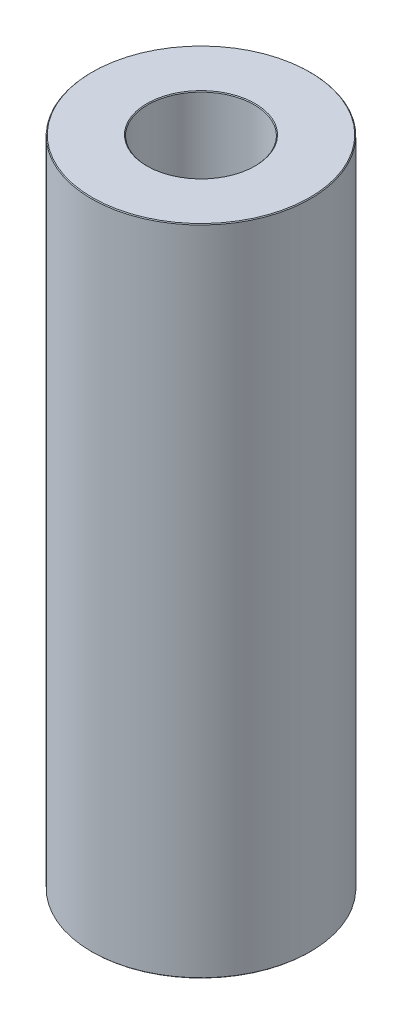
from build123d import *

# Parameters (mm, degrees)
SKETCH1_R           = 50
BOSS_EXTRUDE1_DEPTH = 298.43181448
SKETCH2_R           = 24.378454639
CUT_EXTRUDE1_DEPTH  = 307.694551458
CHAMFER1_SIZE       = 0.345083715


with BuildPart() as part:
    # Sketch1 → Boss-Extrude1 (new body)
    with BuildSketch(Plane(origin=(0, 0, 0), x_dir=(1, 0, 0), z_dir=(0, 1, 0))):
        Circle(SKETCH1_R)
    extrude(amount=BOSS_EXTRUDE1_DEPTH)

    # Sketch2 → Cut-Extrude1 (cut, through all)
    with BuildSketch(Plane(origin=(0, 0, 0), x_dir=(1, 0, 0), z_dir=(0, 1, 0))):
        Circle(SKETCH2_R)
    extrude(amount=CUT_EXTRUDE1_DEPTH, mode=Mode.SUBTRACT)

    # Chamfer1
    chamfer1_edges = [part.edges().sort_by_distance(p)[0] for p in [
        (-24.378454639, 298.43181448, 0),
        (-24.378454639, 0, 0),
        (-50, 0, 0),
        (-50, 298.43181448, 0),
    ]]
    chamfer(chamfer1_edges, length=CHAMFER1_SIZE)


solid = part.part
